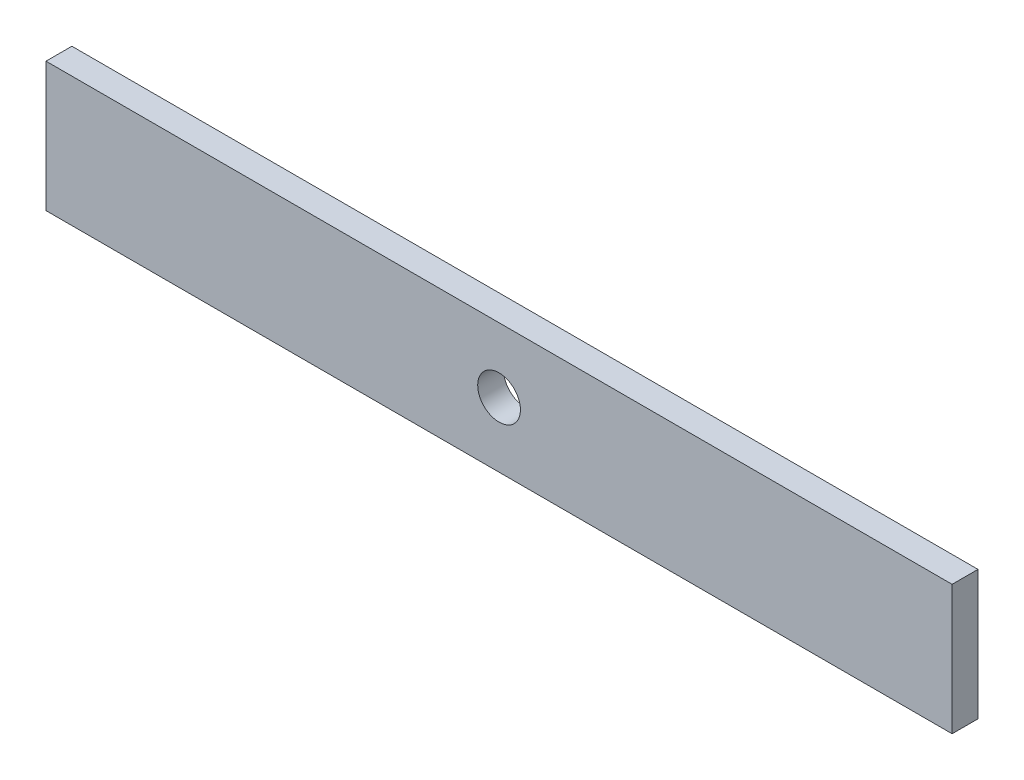
from build123d import *

# Parameters (mm, degrees)
ESBO_O1_W                                      = 70
ESBO_O1_H                                      = 10
FLANGE_BASE1_DEPTH                             = 2
BROCA_DE_ROSQUEAR_DE_CANO_PARA_TARRAXA_D_D     = 3.3
BROCA_DE_ROSQUEAR_DE_CANO_PARA_TARRAXA_D_DEPTH = 4
BROCA_DE_ROSQUEAR_DE_CANO_PARA_TARRAXA_D_TIP   = 0.991420021


# Sheet-metal steps are written as plain solids
with BuildPart() as part:
    # Esboço1 → Flange-base1 (new body)
    with BuildSketch(Plane.XY):
        Rectangle(ESBO_O1_W, ESBO_O1_H)
    extrude(amount=-FLANGE_BASE1_DEPTH)

    # Broca de rosquear de cano para tarraxa de 1/81
    with Locations(Plane(origin=(0, 0, -2), x_dir=(-1, 0, 0), z_dir=(0, 0, -1))):
        with Locations((0, 0)):
            Hole(BROCA_DE_ROSQUEAR_DE_CANO_PARA_TARRAXA_D_D / 2, depth=BROCA_DE_ROSQUEAR_DE_CANO_PARA_TARRAXA_D_DEPTH)
            with Locations((0, 0, -(BROCA_DE_ROSQUEAR_DE_CANO_PARA_TARRAXA_D_DEPTH + BROCA_DE_ROSQUEAR_DE_CANO_PARA_TARRAXA_D_TIP / 2))):  # 118° drill point
                Cone(0, BROCA_DE_ROSQUEAR_DE_CANO_PARA_TARRAXA_D_D / 2, BROCA_DE_ROSQUEAR_DE_CANO_PARA_TARRAXA_D_TIP, mode=Mode.SUBTRACT)


solid = part.part
